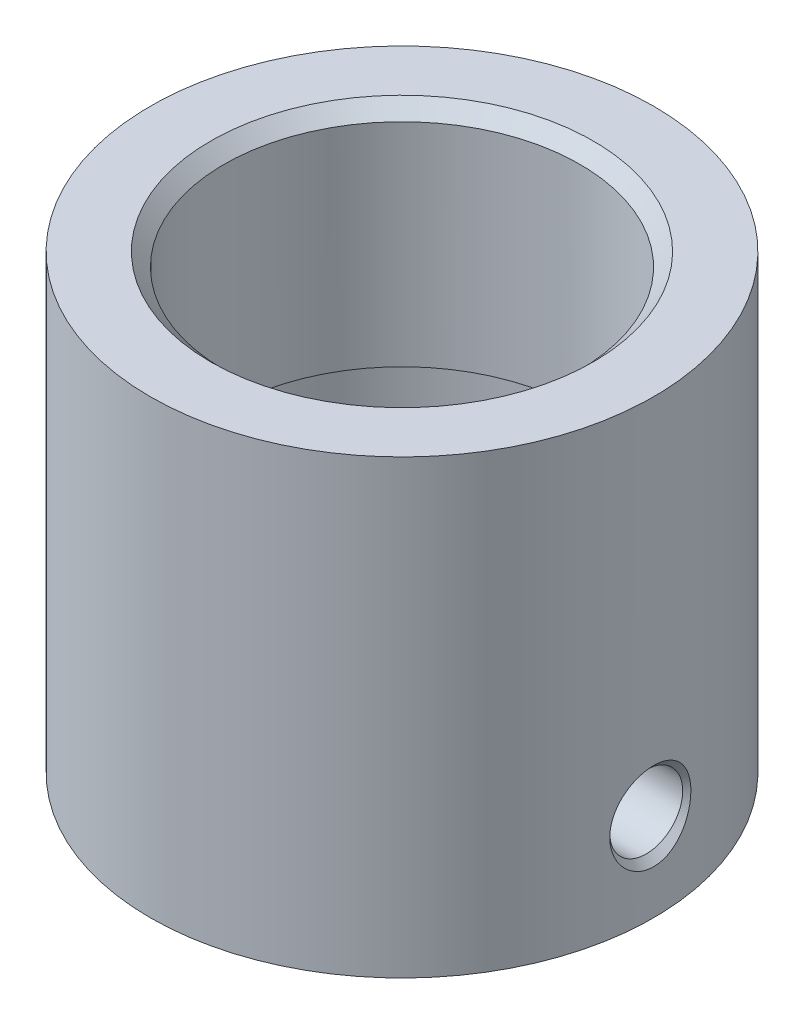
from build123d import *

# Parameters (mm, degrees)
ESBO_O1_R                            = 14.5
RESSALTO_EXTRUS_O1_DEPTH             = 26
ESBO_O2_R                            = 10.5
CORTE_EXTRUS_O2_DEPTH                = 13
FURO_ROSCADO_DE_M22X1_51_D           = 20.5
FURO_ROSCADO_DE_M22X1_51_CSINK_D     = 22.05
FURO_ROSCADO_DE_M22X1_51_CSINK_ANGLE = 90


# Read off the part's stored shape, not the designer's step: Furo roscado de M51
with BuildPart() as part:
    # Esboço1 → Ressalto-extrusão1 (new body)
    with BuildSketch(Plane(origin=(0, 0, 0), x_dir=(1, 0, 0), z_dir=(0, 1, 0))):
        with Locations(Location((0, 0, 0), (0, 0, 90))):
            Circle(ESBO_O1_R)
    extrude(amount=RESSALTO_EXTRUS_O1_DEPTH)

    # Esboço2 → Corte-extrusão2 (cut)
    with BuildSketch(Plane.XZ):
        with Locations(Location((0, 0, 0), (0, 0, 270))):
            Circle(ESBO_O2_R)
    extrude(amount=-CORTE_EXTRUS_O2_DEPTH, mode=Mode.SUBTRACT)

    # Furo roscado de M22x1.51 (through all)
    with Locations(Plane(origin=(0, 26, 0), x_dir=(1, 0, 0), z_dir=(0, 1, 0))):
        with Locations((0, 0)):
            CounterSinkHole(FURO_ROSCADO_DE_M22X1_51_D / 2, FURO_ROSCADO_DE_M22X1_51_CSINK_D / 2, counter_sink_angle=FURO_ROSCADO_DE_M22X1_51_CSINK_ANGLE)

    # Furo roscado de M51 outline → Furo roscado de M51 (revolve, cut)
    with BuildSketch(Plane(origin=(0, 5.075943164, 0), x_dir=(0, 1, 0), z_dir=(0.000288160587710413, 0, -0.999999958481737))):
        Polygon((2.525059426, 14.500059426), (0, 14.500059426), (0, 10.287739691), (2.1, 10.287739691), (2.1, 14.075), align=None)
    revolve(axis=Axis((0, 5.075943164, 0), (0.999999958481737, 0, 0.000288160587710413)), mode=Mode.SUBTRACT)


solid = part.part
